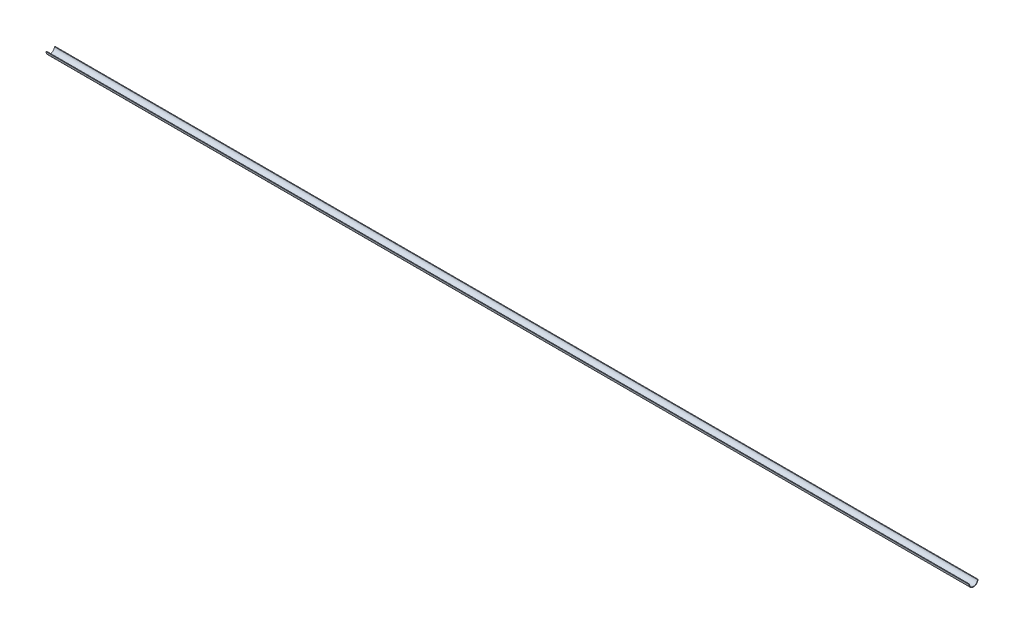
from build123d import *

# Parameters (mm, degrees)
BASPROSKE_W  = 25.4
BASPROSKE_H  = 0.124671916
BORSKE_R     = 0.107638136
BORE_DEPTH   = 50.800002
KEYSKE_W     = 12.7
KEYSKE_H     = 59.582361864
KEYWAY_DEPTH = 50.800002
SCALE1_SCALE = 0.39


with BuildPart() as part:
    # BasProSke → Base-Revolve (revolve)
    with BuildSketch(Plane(origin=(0, 0, 0), x_dir=(1, 0, 0), z_dir=(0, 1, 0))):
        with Locations((12.7, 0.062335958)):
            Rectangle(BASPROSKE_W, BASPROSKE_H)
    revolve(axis=Axis((-10, 0, 0), (1, 0, 0)))

    # BorSke → Bore (cut, symmetric)
    with BuildSketch(Plane(origin=(0, 0, 0), x_dir=(0, 0, -1), z_dir=(1, 0, 0))):
        Circle(BORSKE_R)
    extrude(amount=BORE_DEPTH, both=True, mode=Mode.SUBTRACT)

    # KeySke → Keyway (cut, symmetric)
    with BuildSketch(Plane(origin=(0, 0, 0), x_dir=(0, 0, -1), z_dir=(1, 0, 0))):
        with Locations((0, 29.791180932)):
            Rectangle(KEYSKE_W, KEYSKE_H)
    extrude(amount=KEYWAY_DEPTH, both=True, mode=Mode.SUBTRACT)


with BuildPart() as part_1:
    # Scale1: scaled about (12.7, -0.074079107, 0)
    add(part.part.scale(SCALE1_SCALE).moved(Location((7.747, -0.045188255, 0))))


solid = part_1.part
